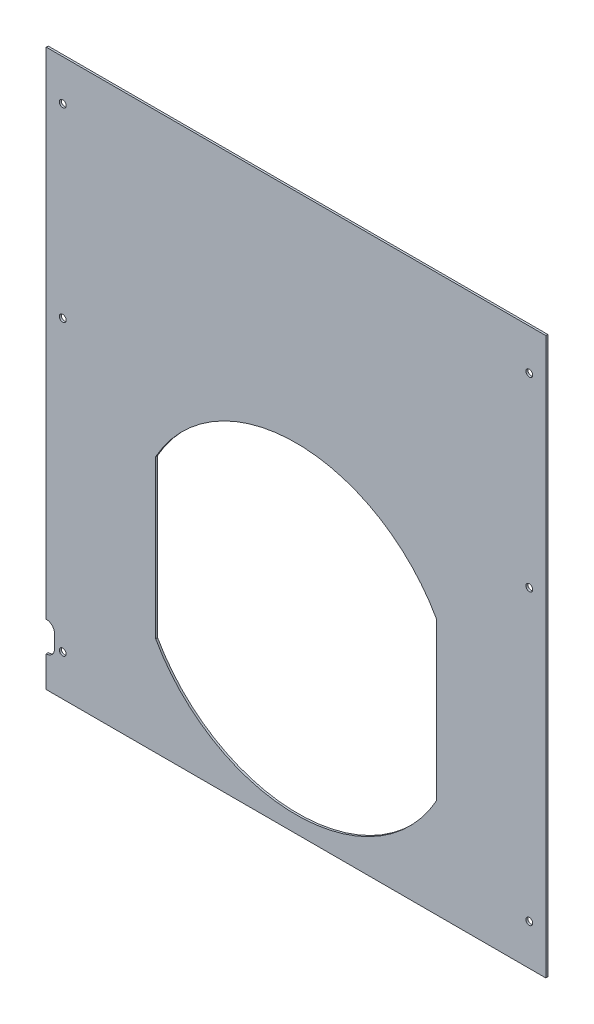
from build123d import *

# Parameters (mm, degrees)
SKETCH1_W               = 484
SKETCH1_H               = 539
BASE_FLANGE1_DEPTH      = 1.89738
M6_CLEARANCE_HOLE1_D    = 6.6
CUT_EXTRUDE1_DEPTH      = 363.212437736
CUT_EXTRUDE1_DEPTH_BACK = 363.212437736


# Sheet-metal steps are written as plain solids
with BuildPart() as part:
    # Sketch1 → Base-Flange1 (new body)
    with BuildSketch(Plane.XY):
        Rectangle(SKETCH1_W, SKETCH1_H)
        with BuildLine():
            Line((136, -21.080107302), (136, -173.919892698))
            ThreePointArc((136, -173.919892698), (0, -253.5), (-136, -173.919892698))
            Line((-136, -173.919892698), (-136, -21.080107302))
            ThreePointArc((-136, -21.080107302), (0, 58.5), (136, -21.080107302))
        make_face(mode=Mode.SUBTRACT)
    extrude(amount=-BASE_FLANGE1_DEPTH)

    # M6 Clearance Hole1 (through all)
    with Locations(Plane(origin=(0, 0, -1.89738), x_dir=(-1, 0, 0), z_dir=(0, 0, -1))):
        with Locations((-226, 230), (226, 230), (226, -230), (-226, -230), (-226, 50), (226, 50)):
            Hole(M6_CLEARANCE_HOLE1_D / 2)

    # Sketch21 → Cut-Extrude1 (cut, two sides: drawn at the far end of the back side and taken through both)
    with BuildSketch(Plane.XY.offset(-CUT_EXTRUDE1_DEPTH_BACK)):
        with BuildLine():
            Line((-234, -218.5), (-234, -231.5))
            ThreePointArc((-234, -231.5), (-236.343145751, -237.156854249), (-242, -239.5))
            Line((-242, -239.5), (-242, -210.5))
            ThreePointArc((-242, -210.5), (-236.343145751, -212.843145751), (-234, -218.5))
        make_face()
    extrude(amount=CUT_EXTRUDE1_DEPTH + CUT_EXTRUDE1_DEPTH_BACK, mode=Mode.SUBTRACT)


solid = part.part
